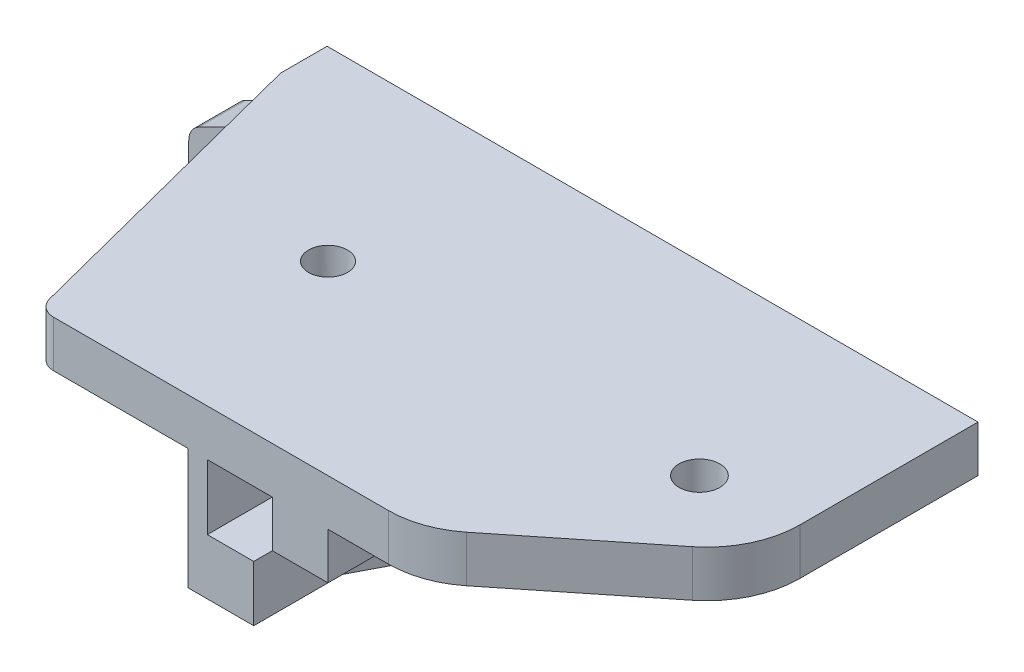
from build123d import *

# Parameters (mm, degrees)
ESQUISSE1_W                   = 50
ESQUISSE1_H                   = 30
BOSS_EXTRU_1_DEPTH            = 40
ESQUISSE2_W                   = 7
ESQUISSE2_H                   = 7
ENL_V_MAT_EXTRU_1_DEPTH       = 50.497474683
ESQUISSE3_W                   = 8
ESQUISSE3_H                   = 10
ENL_V_MAT_EXTRU_2_DEPTH       = 50.497474683
ESQUISSE5_W                   = 34.9
ESQUISSE5_H                   = 30
ENL_V_MAT_EXTRU_4_DEPTH       = 35
ESQUISSE7_R                   = 5.5
ESQUISSE7_R_2                 = 1.8
ENL_V_MAT_EXTRU_6_DEPTH       = 50.497474683
BOSS_EXTRU_2_DEPTH            = 5
ESQUISSE10_R                  = 2.1
ENL_V_MAT_EXTRU_7_DEPTH       = 56.901699437
ESQUISSE11_R                  = 4
ENL_V_MAT_EXTRU_8_DEPTH       = 1
ENL_V_MAT_EXTRU_9_DEPTH       = 46.552167896
CONG_2_R                      = 2
ESQUISSE14_W                  = 13
ESQUISSE14_H                  = 12
ENL_V_MAT_EXTRU_10_DEPTH      = 50.497474683
ESQUISSE15_W                  = 40
ESQUISSE15_H                  = 5
BOSS_EXTRU_3_DEPTH            = 30
ESQUISSE16_R                  = 2.2
ENL_V_MAT_EXTRU_11_DEPTH      = 73.456883731
ESQUISSE17_R                  = 4
ENL_V_MAT_EXTRU_12_DEPTH      = 1
CHANFREIN1_SIZE               = 20
CHANFREIN1_SIZE2              = 16
CONG_3_R                      = 10
CHANFREIN2_SIZE               = 35
CHANFREIN2_SIZE2              = 12
CONG_4_R                      = 10
BODY_MOVE_COPY1_START         = -15
BODY_MOVE_COPY1_OUTLINE_R     = 2.2
BODY_MOVE_COPY1_OUTLINE_R_2   = 2.1
BODY_MOVE_COPY1_DEPTH         = 12
BODY_MOVE_COPY1_START_2       = 10
BODY_MOVE_COPY1_2_OUTLINE_R   = 4
BODY_MOVE_COPY1_2_DEPTH       = 5
BODY_MOVE_COPY1_START_3       = 5
BODY_MOVE_COPY1_3_OUTLINE_W   = 6
BODY_MOVE_COPY1_3_OUTLINE_H   = 40
BODY_MOVE_COPY1_3_DEPTH       = 5
BODY_MOVE_COPY1_START_4       = 7.3595
BODY_MOVE_COPY1_4_DEPTH       = 2.6405
BODY_MOVE_COPY1_START_5       = 11
BODY_MOVE_COPY1_5_OUTLINE_R   = 4
BODY_MOVE_COPY1_5_OUTLINE_R_2 = 2.1
BODY_MOVE_COPY1_5_OUTLINE_R_3 = 2.2
BODY_MOVE_COPY1_5_DEPTH       = 4
BODY_MOVE_COPY1_6_DEPTH       = 5
BODY_MOVE_COPY1_7_DEPTH       = 5
BODY_MOVE_COPY1_START_6       = 9.9
BODY_MOVE_COPY1_8_DEPTH       = 2.1


with BuildPart() as part:
    # Esquisse1 → Boss.-Extru.1 (new body)
    with BuildSketch(Plane.XY):
        Rectangle(ESQUISSE1_W, ESQUISSE1_H)
    extrude(amount=BOSS_EXTRU_1_DEPTH)

    # Esquisse2 → Enlèv. mat.-Extru.1 (cut, through all)
    with BuildSketch(Plane.XY.offset(40)):
        with Locations((15.5, -6.5)):
            Rectangle(ESQUISSE2_W, ESQUISSE2_H)
        with Locations((15.5, 6.5)):
            Rectangle(ESQUISSE2_W, ESQUISSE2_H)
    extrude(amount=-ENL_V_MAT_EXTRU_1_DEPTH, mode=Mode.SUBTRACT)

    # Esquisse3 → Enlèv. mat.-Extru.2 (cut, through all)
    with BuildSketch(Plane.XY.offset(40)):
        with Locations((21, 0)):
            Rectangle(ESQUISSE3_W, ESQUISSE3_H)
    extrude(amount=-ENL_V_MAT_EXTRU_2_DEPTH, mode=Mode.SUBTRACT)

    # Esquisse5 → Enlèv. mat.-Extru.4 (cut)
    with BuildSketch(Plane.XY.offset(40)):
        with Locations((-7.55, 0)):
            Rectangle(ESQUISSE5_W, ESQUISSE5_H)
    extrude(amount=-ENL_V_MAT_EXTRU_4_DEPTH, mode=Mode.SUBTRACT)

    # Esquisse7 → Enlèv. mat.-Extru.6 (cut, through all)
    with BuildSketch(Plane(origin=(0, 0, 0), x_dir=(-1, 0, 0), z_dir=(0, 0, -1))):
        with Locations((9, 0)):
            Circle(ESQUISSE7_R)
        with Locations((22, 0)):
            Circle(ESQUISSE7_R_2)
        with Locations((-4, 0)):
            Circle(ESQUISSE7_R_2)
    extrude(amount=-ENL_V_MAT_EXTRU_6_DEPTH, mode=Mode.SUBTRACT)

    # Esquisse9 → Boss.-Extru.2 (add)
    with BuildSketch(Plane.XZ.offset(15)):
        Polygon((9.9, 40), (-6.1, 40), (-15.1, 5), (9.9, 5), align=None)
    extrude(amount=-BOSS_EXTRU_2_DEPTH)

    # Esquisse10 → Enlèv. mat.-Extru.7 (cut, through all)
    with BuildSketch(Plane.XZ.offset(15)):
        with Locations(Location((5, 20, 0), (0, 0, 270))):
            Circle(ESQUISSE10_R)
    extrude(amount=-ENL_V_MAT_EXTRU_7_DEPTH, mode=Mode.SUBTRACT)

    # Esquisse11 → Enlèv. mat.-Extru.8 (cut)
    with BuildSketch(Plane(origin=(0, -10, 0), x_dir=(1, 0, 0), z_dir=(0, 1, 0))):
        with Locations(Location((5, -20, 0), (0, 0, 270))):
            Circle(ESQUISSE11_R)
    extrude(amount=-ENL_V_MAT_EXTRU_8_DEPTH, mode=Mode.SUBTRACT)

    # Esquisse13 → Enlèv. mat.-Extru.9 (cut, through all)
    with BuildSketch(Plane.XY.offset(5)):
        Polygon((-15.1, -15), (-15.1, -10), (-25, -5), (-25, -15), align=None)
        Polygon((-25, 5), (-15.1, 10), (9.9, 15), (-25, 15), align=None)
    extrude(amount=-ENL_V_MAT_EXTRU_9_DEPTH, mode=Mode.SUBTRACT)

    # Congé2
    cong_2_edges = [part.edges().sort_by_distance(p)[0] for p in [
        (-6.1, -12.5, 40),
        (-25, -5, 2.5),
        (-25, 5, 2.5),
        (-15.1, 10, 2.5),
    ]]
    fillet(cong_2_edges, radius=CONG_2_R)

    # Esquisse14 → Enlèv. mat.-Extru.10 (cut, through all)
    with BuildSketch(Plane.XY.offset(40)):
        with Locations((18.5, 9)):
            Rectangle(ESQUISSE14_W, ESQUISSE14_H)
    extrude(amount=-ENL_V_MAT_EXTRU_10_DEPTH, mode=Mode.SUBTRACT)

    # Esquisse15 → Boss.-Extru.3 (add)
    with BuildSketch(Plane(origin=(25, 0, 0), x_dir=(0, 0, -1), z_dir=(1, 0, 0))):
        with Locations((-20, -12.5)):
            Rectangle(ESQUISSE15_W, ESQUISSE15_H)
    extrude(amount=BOSS_EXTRU_3_DEPTH)

    # Esquisse16 → Enlèv. mat.-Extru.11 (cut, through all)
    with BuildSketch(Plane(origin=(0, -10, 0), x_dir=(1, 0, 0), z_dir=(0, 1, 0))):
        with Locations(Location((45, -20, 0), (0, 0, 180))):
            Circle(ESQUISSE16_R)
    extrude(amount=-ENL_V_MAT_EXTRU_11_DEPTH, mode=Mode.SUBTRACT)

    # Esquisse17 → Enlèv. mat.-Extru.12 (cut)
    with BuildSketch(Plane(origin=(0, -10, 0), x_dir=(1, 0, 0), z_dir=(0, 1, 0))):
        with Locations(Location((45, -20, 0), (0, 0, 180))):
            Circle(ESQUISSE17_R)
    extrude(amount=-ENL_V_MAT_EXTRU_12_DEPTH, mode=Mode.SUBTRACT)

    # Chanfrein1
    chanfrein1_edges = [part.edges().sort_by_distance(p)[0] for p in [
        (55, -12.5, 40),
    ]]
    chanfrein1_side = [part.faces().sort_by_distance(p)[0] for p in [
        (22.378363324, -9.30070091, 40),
    ]]
    chamfer(chanfrein1_edges, length=CHANFREIN1_SIZE, length2=CHANFREIN1_SIZE2, reference=chanfrein1_side[0])

    # Congé3
    cong_3_edges = [part.edges().sort_by_distance(p)[0] for p in [
        (55, -12.5, 24),
    ]]
    fillet(cong_3_edges, radius=CONG_3_R)

    # Chanfrein2
    chanfrein2_edges = [part.edges().sort_by_distance(p)[0] for p in [
        (10.95, 15, 40),
    ]]
    chanfrein2_side = [part.faces().sort_by_distance(p)[0] for p in [
        (10.95, 15, 20),
    ]]
    chamfer(chanfrein2_edges, length=CHANFREIN2_SIZE, length2=CHANFREIN2_SIZE2, reference=chanfrein2_side[0])

    # Congé4
    cong_4_edges = [part.edges().sort_by_distance(p)[0] for p in [
        (35, -12.5, 40),
    ]]
    fillet(cong_4_edges, radius=CONG_4_R)

    # Body-Move/Copy1: read off the stored shape, not the designer's step
    # Body-Move/Copy1 outline → Body-Move/Copy1 (cut)
    with BuildSketch(Plane(origin=(0, 0, 0), x_dir=(1, 0, 0), z_dir=(0, 1, 0)).offset(BODY_MOVE_COPY1_START)):
        with BuildLine():
            Line((55, 0), (-15.1, 0))
            Line((-15.1, 0), (-15.1, -5))
            Line((-15.1, -5), (-6.486207465, -38.49808208))
            ThreePointArc((-6.486207465, -38.49808208), (-5.774749209, -39.580532214), (-4.5492216, -40))
            Line((-4.5492216, -40), (31.492189406, -40))
            ThreePointArc((31.492189406, -40), (34.802258821, -39.436283192), (37.739139882, -37.808688094))
            Line((37.739139882, -37.808688094), (51.246950476, -27.00243962))
            ThreePointArc((51.246950476, -27.00243962), (54.013032363, -23.52563883), (55, -19.193751525))
            Line((55, -19.193751525), (55, 0))
        make_face()
        with Locations((45, -20)):
            Circle(BODY_MOVE_COPY1_OUTLINE_R, mode=Mode.SUBTRACT)
        with Locations((5, -20)):
            Circle(BODY_MOVE_COPY1_OUTLINE_R_2, mode=Mode.SUBTRACT)
    extrude(amount=BODY_MOVE_COPY1_DEPTH, mode=Mode.SUBTRACT)

    # Body-Move_Copy1 2 outline → Body-Move_Copy1 2 (add)
    with BuildSketch(Plane(origin=(0, 0, 0), x_dir=(1, 0, 0), z_dir=(0, 1, 0)).offset(BODY_MOVE_COPY1_START_2)):
        with BuildLine():
            Line((55, 0), (-15.1, 0))
            Line((-15.1, 0), (-15.1, -5))
            Line((-15.1, -5), (-6.486207465, -38.49808208))
            ThreePointArc((-6.486207465, -38.49808208), (-5.774749209, -39.580532214), (-4.5492216, -40))
            Line((-4.5492216, -40), (31.492189406, -40))
            ThreePointArc((31.492189406, -40), (34.802258821, -39.436283192), (37.739139882, -37.808688094))
            Line((37.739139882, -37.808688094), (51.246950476, -27.00243962))
            ThreePointArc((51.246950476, -27.00243962), (54.013032363, -23.52563883), (55, -19.193751525))
            Line((55, -19.193751525), (55, 0))
        make_face()
        with Locations((45, -20)):
            Circle(BODY_MOVE_COPY1_2_OUTLINE_R, mode=Mode.SUBTRACT)
        with Locations((5, -20)):
            Circle(BODY_MOVE_COPY1_2_OUTLINE_R, mode=Mode.SUBTRACT)
    extrude(amount=BODY_MOVE_COPY1_2_DEPTH)

    # Body-Move_Copy1 3 outline → Body-Move_Copy1 3 (add)
    with BuildSketch(Plane(origin=(0, 0, 0), x_dir=(1, 0, 0), z_dir=(0, 1, 0)).offset(BODY_MOVE_COPY1_START_3)):
        with Locations((22, -20)):
            Rectangle(BODY_MOVE_COPY1_3_OUTLINE_W, BODY_MOVE_COPY1_3_OUTLINE_H)
    extrude(amount=BODY_MOVE_COPY1_3_DEPTH)

    # Body-Move_Copy1 4 outline → Body-Move_Copy1 4 (add)
    with BuildSketch(Plane(origin=(0, 0, 0), x_dir=(1, 0, 0), z_dir=(0, 1, 0)).offset(BODY_MOVE_COPY1_START_4)):
        Polygon((12, -40), (12, 0), (-15.1, 0), (-15.1, -5), (9.9, -5), (9.9, -40), align=None)
    extrude(amount=BODY_MOVE_COPY1_4_DEPTH)

    # Body-Move_Copy1 5 outline → Body-Move_Copy1 5 (add)
    # profile 1 of 2: a face of its own
    with BuildSketch(Plane(origin=(0, 0, 0), x_dir=(1, 0, 0), z_dir=(0, 1, 0)).offset(BODY_MOVE_COPY1_START_5)):
        with Locations((5, -20)):
            Circle(BODY_MOVE_COPY1_5_OUTLINE_R)
        with Locations((5, -20)):
            Circle(BODY_MOVE_COPY1_5_OUTLINE_R_2, mode=Mode.SUBTRACT)
    # profile 2 of 2: a face of its own
    with BuildSketch(Plane(origin=(0, 0, 0), x_dir=(1, 0, 0), z_dir=(0, 1, 0)).offset(BODY_MOVE_COPY1_START_5)):
        with Locations((45, -20)):
            Circle(BODY_MOVE_COPY1_5_OUTLINE_R)
        with Locations((45, -20)):
            Circle(BODY_MOVE_COPY1_5_OUTLINE_R_3, mode=Mode.SUBTRACT)
    extrude(amount=BODY_MOVE_COPY1_5_DEPTH)

    # Body-Move_Copy1 6 outline → Body-Move_Copy1 6 (cut)
    with BuildSketch(Plane.XY):
        with BuildLine():
            Line((-15.1, -10), (-15.1, -9.980519257))
            ThreePointArc((-15.1, -9.980519257), (-15.223071437, -9.932967218), (-15.342739808, -9.877404137))
            Line((-15.342739808, -9.877404137), (-15.1, -10))
        make_face()
    extrude(amount=BODY_MOVE_COPY1_6_DEPTH, mode=Mode.SUBTRACT)

    # Body-Move_Copy1 7 outline → Body-Move_Copy1 7 (add)
    with BuildSketch(Plane.XY):
        with BuildLine():
            Line((-14.833339095, -10.053332181), (9.9, -15))
            Line((9.9, -15), (12, -15))
            Line((12, -15), (12, -3))
            Line((12, -3), (-4.390227771, -3))
            ThreePointArc((-4.390227771, -3), (-9, -5.5), (-13.609772229, -3))
            Line((-13.609772229, -3), (-15.1, -3))
            Line((-15.1, -3), (-15.1, -9.980519257))
            ThreePointArc((-15.1, -9.980519257), (-14.967929002, -10.021538185), (-14.833339095, -10.053332181))
        make_face()
        with BuildLine():
            ThreePointArc((-15.342739808, 9.877404137), (-15.223071437, 9.932967218), (-15.1, 9.980519257))
            Line((-15.1, 9.980519257), (-15.1, 10))
            Line((-15.1, 10), (-15.342739808, 9.877404137))
        make_face()
    extrude(amount=BODY_MOVE_COPY1_7_DEPTH)

    # Body-Move_Copy1 8 outline → Body-Move_Copy1 8 (add)
    with BuildSketch(Plane.YZ.offset(BODY_MOVE_COPY1_START_6)):
        Polygon((7.3595, 27.284791667), (7.3595, 40), (3, 40), align=None)
        Polygon((-3, 5), (-3, 40), (-15, 5), align=None)
    extrude(amount=BODY_MOVE_COPY1_8_DEPTH)


solid = part.part
